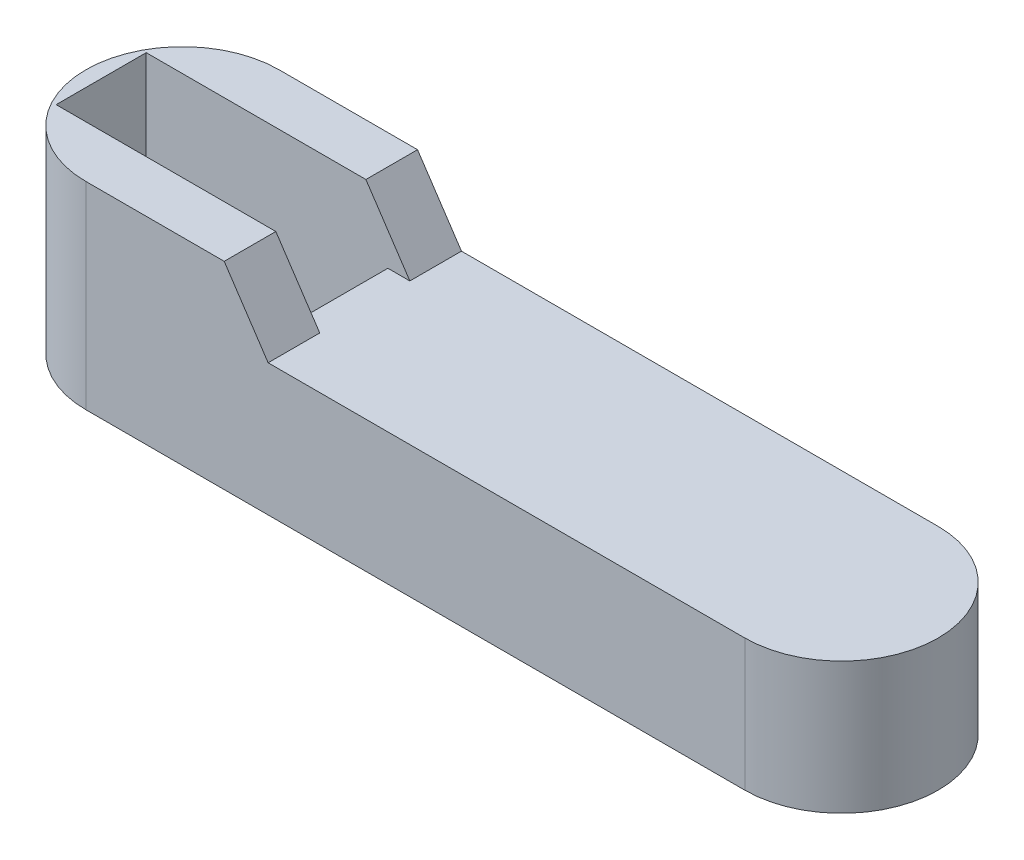
from build123d import *

# Parameters (mm, degrees)
BOSS_EXTRUDE1_DEPTH = 30
SKETCH2_R           = 7
CUT_EXTRUDE1_DEPTH  = 181.055546985
CUT_EXTRUDE2_DEPTH  = 28.5
BOSS_EXTRUDE2_DEPTH = 15
CUT_EXTRUDE3_DEPTH  = 184.152941554
CAVITY1_OUTLINE_R   = 1.02
CAVITY1_DEPTH       = 4.98
CAVITY1_START       = 2.94
CAVITY1_2_OUTLINE_R = 1.683
CAVITY1_2_DEPTH     = 2.04
CAVITY1_START_2     = 4.98
CAVITY1_3_OUTLINE_R = 2.805
CAVITY1_3_DEPTH     = 1.02
SKETCH7_R           = 1.02
SKETCH7_R_2         = 5.61
CUT_EXTRUDE4_DEPTH  = 4.98
SKETCH8_R           = 2.805
CUT_EXTRUDE5_DEPTH  = 1
BOSS_EXTRUDE3_START = 4.98
BOSS_EXTRUDE3_DEPTH = 4.98


with BuildPart() as part:
    # Sketch1 → Boss-Extrude1 (new body)
    with BuildSketch(Plane(origin=(0, 0, 0), x_dir=(1, 0, 0), z_dir=(0, 1, 0))):
        with BuildLine():
            Line((0, 0), (150, 0))
            ThreePointArc((150, 0), (172, 22), (150, 44))
            Line((150, 44), (0, 44))
            ThreePointArc((0, 44), (-22, 22), (0, 0))
        make_face()
    extrude(amount=BOSS_EXTRUDE1_DEPTH)

    # Sketch2 → Cut-Extrude1 (cut, through all)
    with BuildSketch(Plane(origin=(0, 30, 0), x_dir=(1, 0, 0), z_dir=(0, 1, 0))):
        with Locations(Location((0, 22, 0), (0, 0, 270))):
            Circle(SKETCH2_R)
    extrude(amount=-CUT_EXTRUDE1_DEPTH, mode=Mode.SUBTRACT)

    # Sketch3 → Cut-Extrude2 (cut)
    with BuildSketch(Plane(origin=(0, 30, 0), x_dir=(1, 0, 0), z_dir=(0, 1, 0))):
        Polygon((0, 32.25), (-18.5, 32.25), (-18.5, 11.75), (0, 11.75), (36.5, 11.75), (36.5, 32.25), align=None)
    extrude(amount=-CUT_EXTRUDE2_DEPTH, mode=Mode.SUBTRACT)

    # Sketch5 → Boss-Extrude2 (add)
    with BuildSketch(Plane(origin=(0, 30, 0), x_dir=(1, 0, 0), z_dir=(0, 1, 0))):
        with BuildLine():
            Line((-18.5, 32.25), (-18.5, 11.75))
            Line((-18.5, 11.75), (41.5, 11.75))
            Line((41.5, 11.75), (41.5, 0))
            Line((41.5, 0), (0, 0))
            ThreePointArc((0, 0), (-22, 22), (0, 44))
            Line((0, 44), (41.5, 44))
            Line((41.5, 44), (41.5, 32.25))
            Line((41.5, 32.25), (-18.5, 32.25))
        make_face()
    extrude(amount=BOSS_EXTRUDE2_DEPTH)

    # Sketch6 → Cut-Extrude3 (cut, through all)
    with BuildSketch(Plane.XY):
        Polygon((31.5, 45), (41.5, 45), (41.5, 30), align=None)
    extrude(amount=-CUT_EXTRUDE3_DEPTH, mode=Mode.SUBTRACT)

    # Cavity1: read off the stored shape, not the designer's step
    # Cavity1 outline → Cavity1 (cut)
    with BuildSketch(Plane(origin=(0, 0, 0), x_dir=(1, 0, 0), z_dir=(0, 1, 0))):
        with BuildLine():
            ThreePointArc((147.779668933, 12.829975193), (150.080823725, 12.565346189), (152.377107132, 12.869360007))
            Line((152.377107132, 12.869360007), (163.360195023, 4.52129327))
            ThreePointArc((163.360195023, 4.52129327), (165.689039875, 6.577483091), (167.705029876, 8.941213032))
            Line((167.705029876, 8.941213032), (159.170024807, 19.779668933))
            ThreePointArc((159.170024807, 19.779668933), (159.434653811, 22.080823725), (159.130639993, 24.377107132))
            Line((159.130639993, 24.377107132), (167.47870673, 35.360195023))
            ThreePointArc((167.47870673, 35.360195023), (165.422516909, 37.689039875), (163.058786968, 39.705029876))
            Line((163.058786968, 39.705029876), (152.220331067, 31.170024807))
            ThreePointArc((152.220331067, 31.170024807), (149.919176275, 31.434653811), (147.622892868, 31.130639993))
            Line((147.622892868, 31.130639993), (134.649096594, 40.991811842))
            ThreePointArc((134.649096594, 40.991811842), (130.951366883, 40.725037906), (130.747982035, 37.023280491))
            Line((130.747982035, 37.023280491), (140.829975193, 24.220331067))
            ThreePointArc((140.829975193, 24.220331067), (140.565346189, 21.919176275), (140.869360007, 19.622892868))
            Line((140.869360007, 19.622892868), (131.008188158, 6.649096594))
            ThreePointArc((131.008188158, 6.649096594), (131.274962094, 2.951366883), (134.976719509, 2.747982035))
            Line((134.976719509, 2.747982035), (147.779668933, 12.829975193))
        make_face()
        with Locations((133.375227796, 5.087928153)):
            Circle(CAVITY1_OUTLINE_R, mode=Mode.SUBTRACT)
        with Locations((136.950447624, 8.724932851)):
            Circle(CAVITY1_OUTLINE_R, mode=Mode.SUBTRACT)
        with Locations((140.525667453, 12.36193755)):
            Circle(CAVITY1_OUTLINE_R, mode=Mode.SUBTRACT)
        with Locations((144.100887282, 15.998942248)):
            Circle(CAVITY1_OUTLINE_R, mode=Mode.SUBTRACT)
        with Locations((163.275067149, 8.950447624)):
            Circle(CAVITY1_OUTLINE_R, mode=Mode.SUBTRACT)
        with Locations((156.001057752, 16.100887282)):
            Circle(CAVITY1_OUTLINE_R, mode=Mode.SUBTRACT)
        with Locations((159.63806245, 12.525667453)):
            Circle(CAVITY1_OUTLINE_R, mode=Mode.SUBTRACT)
        with Locations((140.36193755, 31.474332547)):
            Circle(CAVITY1_OUTLINE_R, mode=Mode.SUBTRACT)
        with BuildLine():
            Line((152.373607277, 19.467574131), (152.689172923, 18.931653704))
            ThreePointArc((152.689172923, 18.931653704), (152.511383831, 18.784513838), (152.325559725, 18.647661717))
            Line((152.325559725, 18.647661717), (151.882040304, 19.083646698))
            Line((151.882040304, 19.083646698), (151.637288525, 18.939529681))
            Line((151.637288525, 18.939529681), (151.80339512, 18.340195901))
            ThreePointArc((151.80339512, 18.340195901), (151.593581444, 18.244084908), (151.378669205, 18.159990726))
            Line((151.378669205, 18.159990726), (151.063103559, 18.695911153))
            Line((151.063103559, 18.695911153), (150.789391266, 18.620051226))
            Line((150.789391266, 18.620051226), (150.794718919, 17.998147699))
            ThreePointArc((150.794718919, 17.998147699), (150.567179115, 17.959615383), (150.337824658, 17.934010022))
            Line((150.337824658, 17.934010022), (150.171718063, 18.533343802))
            Line((150.171718063, 18.533343802), (149.887698297, 18.530910694))
            Line((149.887698297, 18.530910694), (149.731883937, 17.928819118))
            ThreePointArc((149.731883937, 17.928819118), (149.502124467, 17.950491394), (149.273957918, 17.985119816))
            Line((149.273957918, 17.985119816), (149.268630266, 18.607023342))
            Line((149.268630266, 18.607023342), (148.993658503, 18.678182865))
            Line((148.993658503, 18.678182865), (148.687320622, 18.136934786))
            ThreePointArc((148.687320622, 18.136934786), (148.470999214, 18.217334723), (148.259569747, 18.309837059))
            Line((148.259569747, 18.309837059), (148.415384106, 18.911928635))
            Line((148.415384106, 18.911928635), (148.168199219, 19.051831385))
            Line((148.168199219, 19.051831385), (147.732214237, 18.608311964))
            ThreePointArc((147.732214237, 18.608311964), (147.544072837, 18.74196044), (147.363789021, 18.886032808))
            Line((147.363789021, 18.886032808), (147.670126902, 19.427280887))
            Line((147.670126902, 19.427280887), (147.467574131, 19.626392723))
            Line((147.467574131, 19.626392723), (146.931653704, 19.310827077))
            ThreePointArc((146.931653704, 19.310827077), (146.784513838, 19.488616169), (146.647661717, 19.674440275))
            Line((146.647661717, 19.674440275), (147.083646698, 20.117959696))
            Line((147.083646698, 20.117959696), (146.939529681, 20.362711475))
            Line((146.939529681, 20.362711475), (146.340195901, 20.19660488))
            ThreePointArc((146.340195901, 20.19660488), (146.244084908, 20.406418556), (146.159990726, 20.621330795))
            Line((146.159990726, 20.621330795), (146.695911153, 20.936896441))
            Line((146.695911153, 20.936896441), (146.620051226, 21.210608734))
            Line((146.620051226, 21.210608734), (145.998147699, 21.205281081))
            ThreePointArc((145.998147699, 21.205281081), (145.959615383, 21.432820885), (145.934010022, 21.662175342))
            Line((145.934010022, 21.662175342), (146.533343802, 21.828281937))
            Line((146.533343802, 21.828281937), (146.530910694, 22.112301703))
            Line((146.530910694, 22.112301703), (145.928819118, 22.268116063))
            ThreePointArc((145.928819118, 22.268116063), (145.950491394, 22.497875533), (145.985119816, 22.726042082))
            Line((145.985119816, 22.726042082), (146.607023342, 22.731369734))
            Line((146.607023342, 22.731369734), (146.678182865, 23.006341497))
            Line((146.678182865, 23.006341497), (146.136934786, 23.312679378))
            ThreePointArc((146.136934786, 23.312679378), (146.217334723, 23.529000786), (146.309837059, 23.740430253))
            Line((146.309837059, 23.740430253), (146.911928635, 23.584615894))
            Line((146.911928635, 23.584615894), (147.051831385, 23.831800781))
            Line((147.051831385, 23.831800781), (146.608311964, 24.267785763))
            ThreePointArc((146.608311964, 24.267785763), (146.74196044, 24.455927163), (146.886032808, 24.636210979))
            Line((146.886032808, 24.636210979), (147.427280887, 24.329873098))
            Line((147.427280887, 24.329873098), (147.626392723, 24.532425869))
            Line((147.626392723, 24.532425869), (147.310827077, 25.068346296))
            ThreePointArc((147.310827077, 25.068346296), (147.488616169, 25.215486162), (147.674440275, 25.352338283))
            Line((147.674440275, 25.352338283), (148.117959696, 24.916353302))
            Line((148.117959696, 24.916353302), (148.362711475, 25.060470319))
            Line((148.362711475, 25.060470319), (148.19660488, 25.659804099))
            ThreePointArc((148.19660488, 25.659804099), (148.406418556, 25.755915092), (148.621330795, 25.840009274))
            Line((148.621330795, 25.840009274), (148.936896441, 25.304088847))
            Line((148.936896441, 25.304088847), (149.210608734, 25.379948774))
            Line((149.210608734, 25.379948774), (149.205281081, 26.001852301))
            ThreePointArc((149.205281081, 26.001852301), (149.432820885, 26.040384617), (149.662175342, 26.065989978))
            Line((149.662175342, 26.065989978), (149.828281937, 25.466656198))
            Line((149.828281937, 25.466656198), (150.112301703, 25.469089306))
            Line((150.112301703, 25.469089306), (150.268116063, 26.071180882))
            ThreePointArc((150.268116063, 26.071180882), (150.497875533, 26.049508606), (150.726042082, 26.014880184))
            Line((150.726042082, 26.014880184), (150.731369734, 25.392976658))
            Line((150.731369734, 25.392976658), (151.006341497, 25.321817135))
            Line((151.006341497, 25.321817135), (151.312679378, 25.863065214))
            ThreePointArc((151.312679378, 25.863065214), (151.529000786, 25.782665277), (151.740430253, 25.690162941))
            Line((151.740430253, 25.690162941), (151.584615894, 25.088071365))
            Line((151.584615894, 25.088071365), (151.831800781, 24.948168615))
            Line((151.831800781, 24.948168615), (152.267785763, 25.391688036))
            ThreePointArc((152.267785763, 25.391688036), (152.455927163, 25.25803956), (152.636210979, 25.113967192))
            Line((152.636210979, 25.113967192), (152.329873098, 24.572719113))
            Line((152.329873098, 24.572719113), (152.532425869, 24.373607277))
            Line((152.532425869, 24.373607277), (153.068346296, 24.689172923))
            ThreePointArc((153.068346296, 24.689172923), (153.215486162, 24.511383831), (153.352338283, 24.325559725))
            Line((153.352338283, 24.325559725), (152.916353302, 23.882040304))
            Line((152.916353302, 23.882040304), (153.060470319, 23.637288525))
            Line((153.060470319, 23.637288525), (153.659804099, 23.80339512))
            ThreePointArc((153.659804099, 23.80339512), (153.755915092, 23.593581444), (153.840009274, 23.378669205))
            Line((153.840009274, 23.378669205), (153.304088847, 23.063103559))
            Line((153.304088847, 23.063103559), (153.379948774, 22.789391266))
            Line((153.379948774, 22.789391266), (154.001852301, 22.794718919))
            ThreePointArc((154.001852301, 22.794718919), (154.040384617, 22.567179115), (154.065989978, 22.337824658))
            Line((154.065989978, 22.337824658), (153.466656198, 22.171718063))
            Line((153.466656198, 22.171718063), (153.469089306, 21.887698297))
            Line((153.469089306, 21.887698297), (154.071180882, 21.731883937))
            ThreePointArc((154.071180882, 21.731883937), (154.049508606, 21.502124467), (154.014880184, 21.273957918))
            Line((154.014880184, 21.273957918), (153.392976658, 21.268630266))
            Line((153.392976658, 21.268630266), (153.321817135, 20.993658503))
            Line((153.321817135, 20.993658503), (153.863065214, 20.687320622))
            ThreePointArc((153.863065214, 20.687320622), (153.782665277, 20.470999214), (153.690162941, 20.259569747))
            Line((153.690162941, 20.259569747), (153.088071365, 20.415384106))
            Line((153.088071365, 20.415384106), (152.948168615, 20.168199219))
            Line((152.948168615, 20.168199219), (153.391688036, 19.732214237))
            ThreePointArc((153.391688036, 19.732214237), (153.25803956, 19.544072837), (153.113967192, 19.363789021))
            Line((153.113967192, 19.363789021), (152.572719113, 19.670126902))
            Line((152.572719113, 19.670126902), (152.373607277, 19.467574131))
        make_face(mode=Mode.SUBTRACT)
        with Locations((143.998942248, 27.899112718)):
            Circle(CAVITY1_OUTLINE_R, mode=Mode.SUBTRACT)
        with Locations((136.724932851, 35.049552376)):
            Circle(CAVITY1_OUTLINE_R, mode=Mode.SUBTRACT)
        with Locations((133.087928153, 38.624772204)):
            Circle(CAVITY1_OUTLINE_R, mode=Mode.SUBTRACT)
        with Locations((155.899112718, 28.001057752)):
            Circle(CAVITY1_OUTLINE_R, mode=Mode.SUBTRACT)
        with Locations((159.474332547, 31.63806245)):
            Circle(CAVITY1_OUTLINE_R, mode=Mode.SUBTRACT)
        with Locations((163.049552376, 35.275067149)):
            Circle(CAVITY1_OUTLINE_R, mode=Mode.SUBTRACT)
    extrude(amount=CAVITY1_DEPTH, mode=Mode.SUBTRACT)

    # Cavity1 2 outline → Cavity1 2 (cut)
    with BuildSketch(Plane(origin=(0, 0, 0), x_dir=(1, 0, 0), z_dir=(0, 1, 0)).offset(CAVITY1_START)):
        with BuildLine():
            ThreePointArc((152.325559725, 18.647661717), (152.511383831, 18.784513838), (152.689172923, 18.931653704))
            Line((152.689172923, 18.931653704), (152.373607277, 19.467574131))
            Line((152.373607277, 19.467574131), (152.572719113, 19.670126902))
            Line((152.572719113, 19.670126902), (153.113967192, 19.363789021))
            ThreePointArc((153.113967192, 19.363789021), (153.25803956, 19.544072837), (153.391688036, 19.732214237))
            Line((153.391688036, 19.732214237), (152.948168615, 20.168199219))
            Line((152.948168615, 20.168199219), (153.088071365, 20.415384106))
            Line((153.088071365, 20.415384106), (153.690162941, 20.259569747))
            ThreePointArc((153.690162941, 20.259569747), (153.782665277, 20.470999214), (153.863065214, 20.687320622))
            Line((153.863065214, 20.687320622), (153.321817135, 20.993658503))
            Line((153.321817135, 20.993658503), (153.392976658, 21.268630266))
            Line((153.392976658, 21.268630266), (154.014880184, 21.273957918))
            ThreePointArc((154.014880184, 21.273957918), (154.049508606, 21.502124467), (154.071180882, 21.731883937))
            Line((154.071180882, 21.731883937), (153.469089306, 21.887698297))
            Line((153.469089306, 21.887698297), (153.466656198, 22.171718063))
            Line((153.466656198, 22.171718063), (154.065989978, 22.337824658))
            ThreePointArc((154.065989978, 22.337824658), (154.040384617, 22.567179115), (154.001852301, 22.794718919))
            Line((154.001852301, 22.794718919), (153.379948774, 22.789391266))
            Line((153.379948774, 22.789391266), (153.304088847, 23.063103559))
            Line((153.304088847, 23.063103559), (153.840009274, 23.378669205))
            ThreePointArc((153.840009274, 23.378669205), (153.755915092, 23.593581444), (153.659804099, 23.80339512))
            Line((153.659804099, 23.80339512), (153.060470319, 23.637288525))
            Line((153.060470319, 23.637288525), (152.916353302, 23.882040304))
            Line((152.916353302, 23.882040304), (153.352338283, 24.325559725))
            ThreePointArc((153.352338283, 24.325559725), (153.215486162, 24.511383831), (153.068346296, 24.689172923))
            Line((153.068346296, 24.689172923), (152.532425869, 24.373607277))
            Line((152.532425869, 24.373607277), (152.329873098, 24.572719113))
            Line((152.329873098, 24.572719113), (152.636210979, 25.113967192))
            ThreePointArc((152.636210979, 25.113967192), (152.455927163, 25.25803956), (152.267785763, 25.391688036))
            Line((152.267785763, 25.391688036), (151.831800781, 24.948168615))
            Line((151.831800781, 24.948168615), (151.584615894, 25.088071365))
            Line((151.584615894, 25.088071365), (151.740430253, 25.690162941))
            ThreePointArc((151.740430253, 25.690162941), (151.529000786, 25.782665277), (151.312679378, 25.863065214))
            Line((151.312679378, 25.863065214), (151.006341497, 25.321817135))
            Line((151.006341497, 25.321817135), (150.731369734, 25.392976658))
            Line((150.731369734, 25.392976658), (150.726042082, 26.014880184))
            ThreePointArc((150.726042082, 26.014880184), (150.497875533, 26.049508606), (150.268116063, 26.071180882))
            Line((150.268116063, 26.071180882), (150.112301703, 25.469089306))
            Line((150.112301703, 25.469089306), (149.828281937, 25.466656198))
            Line((149.828281937, 25.466656198), (149.662175342, 26.065989978))
            ThreePointArc((149.662175342, 26.065989978), (149.432820885, 26.040384617), (149.205281081, 26.001852301))
            Line((149.205281081, 26.001852301), (149.210608734, 25.379948774))
            Line((149.210608734, 25.379948774), (148.936896441, 25.304088847))
            Line((148.936896441, 25.304088847), (148.621330795, 25.840009274))
            ThreePointArc((148.621330795, 25.840009274), (148.406418556, 25.755915092), (148.19660488, 25.659804099))
            Line((148.19660488, 25.659804099), (148.362711475, 25.060470319))
            Line((148.362711475, 25.060470319), (148.117959696, 24.916353302))
            Line((148.117959696, 24.916353302), (147.674440275, 25.352338283))
            ThreePointArc((147.674440275, 25.352338283), (147.488616169, 25.215486162), (147.310827077, 25.068346296))
            Line((147.310827077, 25.068346296), (147.626392723, 24.532425869))
            Line((147.626392723, 24.532425869), (147.427280887, 24.329873098))
            Line((147.427280887, 24.329873098), (146.886032808, 24.636210979))
            ThreePointArc((146.886032808, 24.636210979), (146.74196044, 24.455927163), (146.608311964, 24.267785763))
            Line((146.608311964, 24.267785763), (147.051831385, 23.831800781))
            Line((147.051831385, 23.831800781), (146.911928635, 23.584615894))
            Line((146.911928635, 23.584615894), (146.309837059, 23.740430253))
            ThreePointArc((146.309837059, 23.740430253), (146.217334723, 23.529000786), (146.136934786, 23.312679378))
            Line((146.136934786, 23.312679378), (146.678182865, 23.006341497))
            Line((146.678182865, 23.006341497), (146.607023342, 22.731369734))
            Line((146.607023342, 22.731369734), (145.985119816, 22.726042082))
            ThreePointArc((145.985119816, 22.726042082), (145.950491394, 22.497875533), (145.928819118, 22.268116063))
            Line((145.928819118, 22.268116063), (146.530910694, 22.112301703))
            Line((146.530910694, 22.112301703), (146.533343802, 21.828281937))
            Line((146.533343802, 21.828281937), (145.934010022, 21.662175342))
            ThreePointArc((145.934010022, 21.662175342), (145.959615383, 21.432820885), (145.998147699, 21.205281081))
            Line((145.998147699, 21.205281081), (146.620051226, 21.210608734))
            Line((146.620051226, 21.210608734), (146.695911153, 20.936896441))
            Line((146.695911153, 20.936896441), (146.159990726, 20.621330795))
            ThreePointArc((146.159990726, 20.621330795), (146.244084908, 20.406418556), (146.340195901, 20.19660488))
            Line((146.340195901, 20.19660488), (146.939529681, 20.362711475))
            Line((146.939529681, 20.362711475), (147.083646698, 20.117959696))
            Line((147.083646698, 20.117959696), (146.647661717, 19.674440275))
            ThreePointArc((146.647661717, 19.674440275), (146.784513838, 19.488616169), (146.931653704, 19.310827077))
            Line((146.931653704, 19.310827077), (147.467574131, 19.626392723))
            Line((147.467574131, 19.626392723), (147.670126902, 19.427280887))
            Line((147.670126902, 19.427280887), (147.363789021, 18.886032808))
            ThreePointArc((147.363789021, 18.886032808), (147.544072837, 18.74196044), (147.732214237, 18.608311964))
            Line((147.732214237, 18.608311964), (148.168199219, 19.051831385))
            Line((148.168199219, 19.051831385), (148.415384106, 18.911928635))
            Line((148.415384106, 18.911928635), (148.259569747, 18.309837059))
            ThreePointArc((148.259569747, 18.309837059), (148.470999214, 18.217334723), (148.687320622, 18.136934786))
            Line((148.687320622, 18.136934786), (148.993658503, 18.678182865))
            Line((148.993658503, 18.678182865), (149.268630266, 18.607023342))
            Line((149.268630266, 18.607023342), (149.273957918, 17.985119816))
            ThreePointArc((149.273957918, 17.985119816), (149.502124467, 17.950491394), (149.731883937, 17.928819118))
            Line((149.731883937, 17.928819118), (149.887698297, 18.530910694))
            Line((149.887698297, 18.530910694), (150.171718063, 18.533343802))
            Line((150.171718063, 18.533343802), (150.337824658, 17.934010022))
            ThreePointArc((150.337824658, 17.934010022), (150.567179115, 17.959615383), (150.794718919, 17.998147699))
            Line((150.794718919, 17.998147699), (150.789391266, 18.620051226))
            Line((150.789391266, 18.620051226), (151.063103559, 18.695911153))
            Line((151.063103559, 18.695911153), (151.378669205, 18.159990726))
            ThreePointArc((151.378669205, 18.159990726), (151.593581444, 18.244084908), (151.80339512, 18.340195901))
            Line((151.80339512, 18.340195901), (151.637288525, 18.939529681))
            Line((151.637288525, 18.939529681), (151.882040304, 19.083646698))
            Line((151.882040304, 19.083646698), (152.325559725, 18.647661717))
        make_face()
        with Locations((150, 22)):
            Circle(CAVITY1_2_OUTLINE_R, mode=Mode.SUBTRACT)
    extrude(amount=CAVITY1_2_DEPTH, mode=Mode.SUBTRACT)

    # Cavity1 3 outline → Cavity1 3 (cut)
    with BuildSketch(Plane(origin=(0, 0, 0), x_dir=(1, 0, 0), z_dir=(0, 1, 0)).offset(CAVITY1_START_2)):
        with BuildLine():
            ThreePointArc((152.325559725, 18.647661717), (152.511383831, 18.784513838), (152.689172923, 18.931653704))
            Line((152.689172923, 18.931653704), (152.373607277, 19.467574131))
            Line((152.373607277, 19.467574131), (152.572719113, 19.670126902))
            Line((152.572719113, 19.670126902), (153.113967192, 19.363789021))
            ThreePointArc((153.113967192, 19.363789021), (153.25803956, 19.544072837), (153.391688036, 19.732214237))
            Line((153.391688036, 19.732214237), (152.948168615, 20.168199219))
            Line((152.948168615, 20.168199219), (153.088071365, 20.415384106))
            Line((153.088071365, 20.415384106), (153.690162941, 20.259569747))
            ThreePointArc((153.690162941, 20.259569747), (153.782665277, 20.470999214), (153.863065214, 20.687320622))
            Line((153.863065214, 20.687320622), (153.321817135, 20.993658503))
            Line((153.321817135, 20.993658503), (153.392976658, 21.268630266))
            Line((153.392976658, 21.268630266), (154.014880184, 21.273957918))
            ThreePointArc((154.014880184, 21.273957918), (154.049508606, 21.502124467), (154.071180882, 21.731883937))
            Line((154.071180882, 21.731883937), (153.469089306, 21.887698297))
            Line((153.469089306, 21.887698297), (153.466656198, 22.171718063))
            Line((153.466656198, 22.171718063), (154.065989978, 22.337824658))
            ThreePointArc((154.065989978, 22.337824658), (154.040384617, 22.567179115), (154.001852301, 22.794718919))
            Line((154.001852301, 22.794718919), (153.379948774, 22.789391266))
            Line((153.379948774, 22.789391266), (153.304088847, 23.063103559))
            Line((153.304088847, 23.063103559), (153.840009274, 23.378669205))
            ThreePointArc((153.840009274, 23.378669205), (153.755915092, 23.593581444), (153.659804099, 23.80339512))
            Line((153.659804099, 23.80339512), (153.060470319, 23.637288525))
            Line((153.060470319, 23.637288525), (152.916353302, 23.882040304))
            Line((152.916353302, 23.882040304), (153.352338283, 24.325559725))
            ThreePointArc((153.352338283, 24.325559725), (153.215486162, 24.511383831), (153.068346296, 24.689172923))
            Line((153.068346296, 24.689172923), (152.532425869, 24.373607277))
            Line((152.532425869, 24.373607277), (152.329873098, 24.572719113))
            Line((152.329873098, 24.572719113), (152.636210979, 25.113967192))
            ThreePointArc((152.636210979, 25.113967192), (152.455927163, 25.25803956), (152.267785763, 25.391688036))
            Line((152.267785763, 25.391688036), (151.831800781, 24.948168615))
            Line((151.831800781, 24.948168615), (151.584615894, 25.088071365))
            Line((151.584615894, 25.088071365), (151.740430253, 25.690162941))
            ThreePointArc((151.740430253, 25.690162941), (151.529000786, 25.782665277), (151.312679378, 25.863065214))
            Line((151.312679378, 25.863065214), (151.006341497, 25.321817135))
            Line((151.006341497, 25.321817135), (150.731369734, 25.392976658))
            Line((150.731369734, 25.392976658), (150.726042082, 26.014880184))
            ThreePointArc((150.726042082, 26.014880184), (150.497875533, 26.049508606), (150.268116063, 26.071180882))
            Line((150.268116063, 26.071180882), (150.112301703, 25.469089306))
            Line((150.112301703, 25.469089306), (149.828281937, 25.466656198))
            Line((149.828281937, 25.466656198), (149.662175342, 26.065989978))
            ThreePointArc((149.662175342, 26.065989978), (149.432820885, 26.040384617), (149.205281081, 26.001852301))
            Line((149.205281081, 26.001852301), (149.210608734, 25.379948774))
            Line((149.210608734, 25.379948774), (148.936896441, 25.304088847))
            Line((148.936896441, 25.304088847), (148.621330795, 25.840009274))
            ThreePointArc((148.621330795, 25.840009274), (148.406418556, 25.755915092), (148.19660488, 25.659804099))
            Line((148.19660488, 25.659804099), (148.362711475, 25.060470319))
            Line((148.362711475, 25.060470319), (148.117959696, 24.916353302))
            Line((148.117959696, 24.916353302), (147.674440275, 25.352338283))
            ThreePointArc((147.674440275, 25.352338283), (147.488616169, 25.215486162), (147.310827077, 25.068346296))
            Line((147.310827077, 25.068346296), (147.626392723, 24.532425869))
            Line((147.626392723, 24.532425869), (147.427280887, 24.329873098))
            Line((147.427280887, 24.329873098), (146.886032808, 24.636210979))
            ThreePointArc((146.886032808, 24.636210979), (146.74196044, 24.455927163), (146.608311964, 24.267785763))
            Line((146.608311964, 24.267785763), (147.051831385, 23.831800781))
            Line((147.051831385, 23.831800781), (146.911928635, 23.584615894))
            Line((146.911928635, 23.584615894), (146.309837059, 23.740430253))
            ThreePointArc((146.309837059, 23.740430253), (146.217334723, 23.529000786), (146.136934786, 23.312679378))
            Line((146.136934786, 23.312679378), (146.678182865, 23.006341497))
            Line((146.678182865, 23.006341497), (146.607023342, 22.731369734))
            Line((146.607023342, 22.731369734), (145.985119816, 22.726042082))
            ThreePointArc((145.985119816, 22.726042082), (145.950491394, 22.497875533), (145.928819118, 22.268116063))
            Line((145.928819118, 22.268116063), (146.530910694, 22.112301703))
            Line((146.530910694, 22.112301703), (146.533343802, 21.828281937))
            Line((146.533343802, 21.828281937), (145.934010022, 21.662175342))
            ThreePointArc((145.934010022, 21.662175342), (145.959615383, 21.432820885), (145.998147699, 21.205281081))
            Line((145.998147699, 21.205281081), (146.620051226, 21.210608734))
            Line((146.620051226, 21.210608734), (146.695911153, 20.936896441))
            Line((146.695911153, 20.936896441), (146.159990726, 20.621330795))
            ThreePointArc((146.159990726, 20.621330795), (146.244084908, 20.406418556), (146.340195901, 20.19660488))
            Line((146.340195901, 20.19660488), (146.939529681, 20.362711475))
            Line((146.939529681, 20.362711475), (147.083646698, 20.117959696))
            Line((147.083646698, 20.117959696), (146.647661717, 19.674440275))
            ThreePointArc((146.647661717, 19.674440275), (146.784513838, 19.488616169), (146.931653704, 19.310827077))
            Line((146.931653704, 19.310827077), (147.467574131, 19.626392723))
            Line((147.467574131, 19.626392723), (147.670126902, 19.427280887))
            Line((147.670126902, 19.427280887), (147.363789021, 18.886032808))
            ThreePointArc((147.363789021, 18.886032808), (147.544072837, 18.74196044), (147.732214237, 18.608311964))
            Line((147.732214237, 18.608311964), (148.168199219, 19.051831385))
            Line((148.168199219, 19.051831385), (148.415384106, 18.911928635))
            Line((148.415384106, 18.911928635), (148.259569747, 18.309837059))
            ThreePointArc((148.259569747, 18.309837059), (148.470999214, 18.217334723), (148.687320622, 18.136934786))
            Line((148.687320622, 18.136934786), (148.993658503, 18.678182865))
            Line((148.993658503, 18.678182865), (149.268630266, 18.607023342))
            Line((149.268630266, 18.607023342), (149.273957918, 17.985119816))
            ThreePointArc((149.273957918, 17.985119816), (149.502124467, 17.950491394), (149.731883937, 17.928819118))
            Line((149.731883937, 17.928819118), (149.887698297, 18.530910694))
            Line((149.887698297, 18.530910694), (150.171718063, 18.533343802))
            Line((150.171718063, 18.533343802), (150.337824658, 17.934010022))
            ThreePointArc((150.337824658, 17.934010022), (150.567179115, 17.959615383), (150.794718919, 17.998147699))
            Line((150.794718919, 17.998147699), (150.789391266, 18.620051226))
            Line((150.789391266, 18.620051226), (151.063103559, 18.695911153))
            Line((151.063103559, 18.695911153), (151.378669205, 18.159990726))
            ThreePointArc((151.378669205, 18.159990726), (151.593581444, 18.244084908), (151.80339512, 18.340195901))
            Line((151.80339512, 18.340195901), (151.637288525, 18.939529681))
            Line((151.637288525, 18.939529681), (151.882040304, 19.083646698))
            Line((151.882040304, 19.083646698), (152.325559725, 18.647661717))
        make_face()
        with Locations((150, 22)):
            Circle(CAVITY1_3_OUTLINE_R, mode=Mode.SUBTRACT)
    extrude(amount=CAVITY1_3_DEPTH, mode=Mode.SUBTRACT)

    # Cavity1 4 outline → Cavity1 4 (revolve, cut)
    with BuildSketch(Plane(origin=(150, 0, -22), x_dir=(1, 0, 0), z_dir=(0, 0, 1))):
        Polygon((2.805, 6), (2.805, 4.98), (5.61, 4.98), (4.59, 6), align=None)
    revolve(axis=Axis((150, 0, -22), (0, 1, 0)), mode=Mode.SUBTRACT)

    # Sketch7 → Cut-Extrude4 (cut)
    with BuildSketch(Plane.XZ):
        with Locations((133.375227796, -5.087928153)):
            Circle(SKETCH7_R)
        with Locations((136.950447624, -8.724932851)):
            Circle(SKETCH7_R)
        with Locations((140.525667453, -12.36193755)):
            Circle(SKETCH7_R)
        with Locations((144.100887282, -15.998942248)):
            Circle(SKETCH7_R)
        with Locations((156.001057752, -16.100887282)):
            Circle(SKETCH7_R)
        with Locations((159.63806245, -12.525667453)):
            Circle(SKETCH7_R)
        with Locations((163.275067149, -8.950447624)):
            Circle(SKETCH7_R)
        with Locations((143.998942248, -27.899112718)):
            Circle(SKETCH7_R)
        with Locations((140.36193755, -31.474332547)):
            Circle(SKETCH7_R)
        with Locations((136.724932851, -35.049552376)):
            Circle(SKETCH7_R)
        with Locations((133.087928153, -38.624772204)):
            Circle(SKETCH7_R)
        with Locations((155.899112718, -28.001057752)):
            Circle(SKETCH7_R)
        with Locations((159.474332547, -31.63806245)):
            Circle(SKETCH7_R)
        with Locations((163.049552376, -35.275067149)):
            Circle(SKETCH7_R)
        with Locations((150, -22)):
            Circle(SKETCH7_R_2)
    extrude(amount=-CUT_EXTRUDE4_DEPTH, mode=Mode.SUBTRACT)

    # Sketch8 → Cut-Extrude5 (cut)
    with BuildSketch(Plane.XZ.offset(-4.98)):
        with Locations(Location((150, -22, 0), (0, 0, 44.509177003))):
            Circle(SKETCH8_R)
    extrude(amount=-CUT_EXTRUDE5_DEPTH, mode=Mode.SUBTRACT)

    # Sketch9 → Boss-Extrude3 (add)
    with BuildSketch(Plane.XZ.offset(-4.98).offset(BOSS_EXTRUDE3_START)):
        with BuildLine():
            Line((161.767934886, -5.731544342), (163.360195023, -4.52129327))
            ThreePointArc((163.360195023, -4.52129327), (165.689039875, -6.577483091), (167.705029876, -8.941213032))
            Line((167.705029876, -8.941213032), (166.467677642, -10.512505318))
            Line((166.467677642, -10.512505318), (161.767934886, -5.731544342))
        make_face()
        with BuildLine():
            Line((167.47870673, -35.360195023), (166.268455658, -33.767934886))
            Line((166.268455658, -33.767934886), (161.487494682, -38.467677642))
            Line((161.487494682, -38.467677642), (163.058786968, -39.705029876))
            ThreePointArc((163.058786968, -39.705029876), (165.422516909, -37.689039875), (167.47870673, -35.360195023))
        make_face()
    extrude(amount=-BOSS_EXTRUDE3_DEPTH)


solid = part.part
